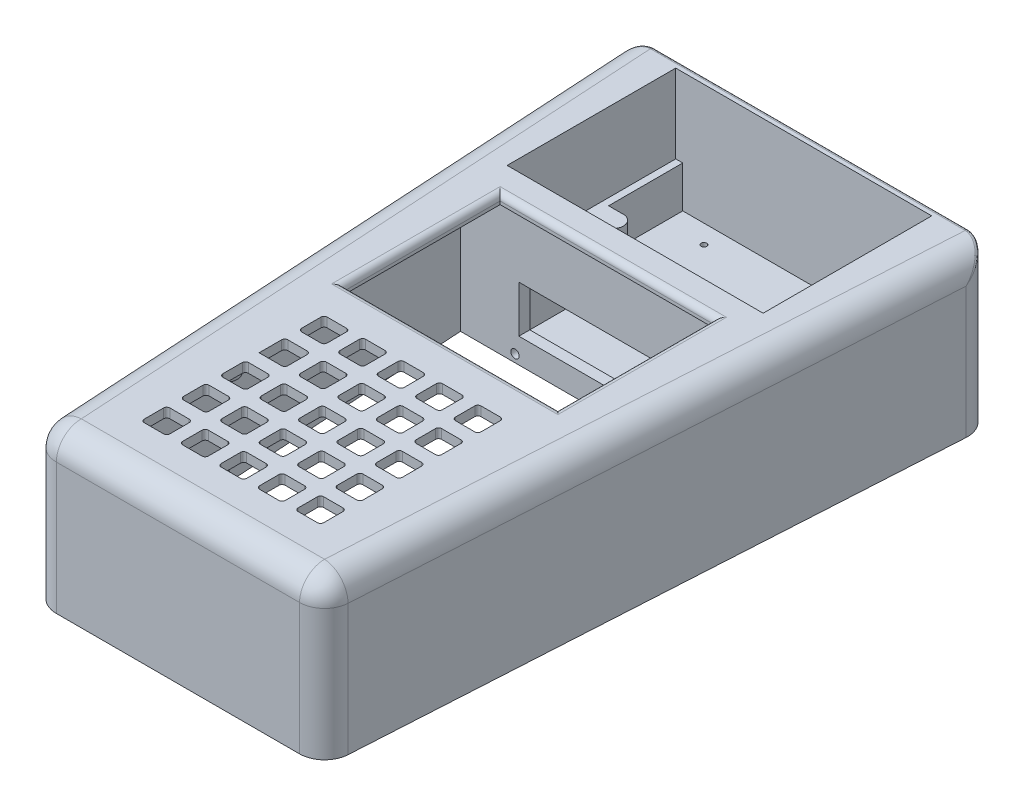
from build123d import *

# Parameters (mm, degrees)
BOSS_EXTRUDE1_DEPTH           = 50
CUT_EXTRUDE1_DEPTH            = 47
CUT_EXTRUDE2_DEPTH            = 47
BOSS_EXTRUDE2_DEPTH           = 21.8
BOSS_EXTRUDE3_DEPTH           = 8.5
CUT_EXTRUDE3_START            = -11.5
CUT_EXTRUDE3_DEPTH            = 9.5
CUT_EXTRUDE4_REACH            = 125.33
SKETCH7_R                     = 0.9
SKETCH9_W                     = 68.5
SKETCH9_H                     = 50
SKETCH9_W_2                   = 8.2
SKETCH9_H_2                   = 8.2
CUT_EXTRUDE5_DEPTH            = 3
SKETCH11_R                    = 4.5
BOSS_EXTRUDE4_DEPTH           = 4
BOSS_EXTRUDE4_DRAFT           = 10
BOSS_EXTRUDE4_PROFILE_2_DEPTH = 4
BOSS_EXTRUDE4_PROFILE_2_DRAFT = 10
BOSS_EXTRUDE4_PROFILE_3_DEPTH = 4
BOSS_EXTRUDE4_PROFILE_3_DRAFT = 10
BOSS_EXTRUDE4_PROFILE_4_DEPTH = 4
BOSS_EXTRUDE4_PROFILE_4_DRAFT = 10
SKETCH11_3_R                  = 1.5
CUT_EXTRUDE6_DEPTH            = 5.5
BOSS_EXTRUDE6_DEPTH           = 25.2
FILLET2_R                     = 8
SKETCH13_R                    = 1.35
CUT_EXTRUDE7_DEPTH            = 3.499991308
SKETCH14_R                    = 1.35
CUT_EXTRUDE8_DEPTH            = 2
SKETCH15_R                    = 1.35
CUT_EXTRUDE9_DEPTH            = 2
FILLET3_R                     = 8
BOSS_EXTRUDE8_START           = -47
BOSS_EXTRUDE8_DEPTH           = 47
FILLET4_R                     = 5
SKETCH18_R                    = 1.5
CUT_EXTRUDE10_DEPTH           = 8
FILLET5_R                     = 1
FILLET6_R                     = 2
FILLET7_R                     = 1.2
CUT_EXTRUDE11_REACH           = 167.321


with BuildPart() as part:
    # Sketch1 → Boss-Extrude1 (new body)
    with BuildSketch(Plane(origin=(0, 0, 0), x_dir=(1, 0, 0), z_dir=(0, 1, 0))):
        Polygon((-46.529702712, 101.499995654), (-58.529702712, 101.499995654), (-46.470297288, -101.499995654), (46.529702712, -101.499995654), (58.470297288, 101.499995654), (46.470297288, 101.499995654), align=None)
    extrude(amount=BOSS_EXTRUDE1_DEPTH)

    # Sketch2 → Cut-Extrude1 (cut)
    with BuildSketch(Plane.XZ):
        Polygon((52.436736768, -41.500004346), (-52.460939346, -41.500004346), (-44.114404692, 98.999995654), (44.172433272, 98.999995654), align=None)
    extrude(amount=-CUT_EXTRUDE1_DEPTH, mode=Mode.SUBTRACT)

    # Sketch3 → Cut-Extrude2 (cut)
    with BuildSketch(Plane(origin=(0, 50, 0), x_dir=(1, 0, 0), z_dir=(0, 1, 0))):
        Polygon((-52.668859621, 44.999995654), (52.642608586, 44.999995654), (55.81892452, 98.999995654), (-55.876780414, 98.999995654), align=None)
    extrude(amount=-CUT_EXTRUDE2_DEPTH, mode=Mode.SUBTRACT)

    # Sketch4 → Boss-Extrude2 (add)
    with BuildSketch(Plane(origin=(0, 3, 0), x_dir=(1, 0, 0), z_dir=(0, 1, 0))):
        with BuildLine():
            Line((38.723219586, 68.749995654), (33.973219586, 68.749995654))
            ThreePointArc((33.973219586, 68.749995654), (30.723219586, 71.999995654), (33.973219586, 75.249995654))
            Line((33.973219586, 75.249995654), (38.723219586, 75.249995654))
            Line((38.723219586, 75.249995654), (38.723219586, 98.999995654))
            Line((38.723219586, 98.999995654), (55.81892452, 98.999995654))
            Line((55.81892452, 98.999995654), (52.642608586, 44.999995654))
            Line((52.642608586, 44.999995654), (38.723219586, 44.999995654))
            Line((38.723219586, 44.999995654), (38.723219586, 68.749995654))
        make_face()
        with BuildLine():
            Line((-38.776780414, 75.249995654), (-34.026780414, 75.249995654))
            ThreePointArc((-34.026780414, 75.249995654), (-30.776780414, 71.999995654), (-34.026780414, 68.749995654))
            Line((-34.026780414, 68.749995654), (-38.776780414, 68.749995654))
            Line((-38.776780414, 68.749995654), (-38.776780414, 44.999995654))
            Line((-38.776780414, 44.999995654), (-52.668859621, 44.999995654))
            Line((-52.668859621, 44.999995654), (-55.876780414, 98.999995654))
            Line((-55.876780414, 98.999995654), (-38.776780414, 98.999995654))
            Line((-38.776780414, 98.999995654), (-38.776780414, 75.249995654))
        make_face()
    extrude(amount=BOSS_EXTRUDE2_DEPTH)

    # Sketch5 → Boss-Extrude3 (add)
    with BuildSketch(Plane(origin=(0, 3, 0), x_dir=(1, 0, 0), z_dir=(0, 1, 0))):
        with BuildLine():
            Line((-38.776780414, 62.499995654), (28.723219586, 62.499995654))
            Line((28.723219586, 62.499995654), (28.723219586, 44.999995654))
            Line((28.723219586, 44.999995654), (38.723219586, 44.999995654))
            Line((38.723219586, 44.999995654), (38.723219586, 68.749995654))
            Line((38.723219586, 68.749995654), (33.973219586, 68.749995654))
            ThreePointArc((33.973219586, 68.749995654), (30.723219586, 71.999995654), (33.973219586, 75.249995654))
            Line((33.973219586, 75.249995654), (38.723219586, 75.249995654))
            Line((38.723219586, 75.249995654), (38.723219586, 98.999995654))
            Line((38.723219586, 98.999995654), (-38.776780414, 98.999995654))
            Line((-38.776780414, 98.999995654), (-38.776780414, 75.249995654))
            Line((-38.776780414, 75.249995654), (-34.026780414, 75.249995654))
            ThreePointArc((-34.026780414, 75.249995654), (-30.776780414, 71.999995654), (-34.026780414, 68.749995654))
            Line((-34.026780414, 68.749995654), (-38.776780414, 68.749995654))
            Line((-38.776780414, 68.749995654), (-38.776780414, 62.499995654))
        make_face()
    extrude(amount=BOSS_EXTRUDE3_DEPTH)

    # Sketch6 → Cut-Extrude3 (cut)
    with BuildSketch(Plane(origin=(0, 11.5, 0), x_dir=(1, 0, 0), z_dir=(0, 1, 0)).offset(CUT_EXTRUDE3_START)):
        Polygon((-33.776780414, 63.999995654), (30.223219586, 63.999995654), (30.223219586, 49.999995654), (36.723219586, 49.999995654), (36.723219586, 95.999995654), (-33.776780414, 95.999995654), align=None)
    extrude(amount=CUT_EXTRUDE3_DEPTH, mode=Mode.SUBTRACT)

    # Sketch7 → Cut-Extrude4 (cut, up to next)
    with BuildSketch(Plane(origin=(0, 11.5, 0), x_dir=(1, 0, 0), z_dir=(0, 1, 0)), mode=Mode.PRIVATE) as cut_extrude4_sk1:
        with Locations(Location((-25.976780414, 92.999995654, 0), (0, 0, 270))):
            Circle(SKETCH7_R)
    cut_extrude4_tool1 = extrude(cut_extrude4_sk1.sketch, amount=-CUT_EXTRUDE4_REACH, mode=Mode.PRIVATE) & part.part
    # Sketch7 → Cut-Extrude4 (cut, up to next)
    with BuildSketch(Plane(origin=(0, 11.5, 0), x_dir=(1, 0, 0), z_dir=(0, 1, 0)), mode=Mode.PRIVATE) as cut_extrude4_sk2:
        with Locations(Location((-27.676780414, 68.099995654, 0), (0, 0, 270))):
            Circle(SKETCH7_R)
    cut_extrude4_tool2 = extrude(cut_extrude4_sk2.sketch, amount=-CUT_EXTRUDE4_REACH, mode=Mode.PRIVATE) & part.part
    # Sketch7 → Cut-Extrude4 (cut, up to next)
    with BuildSketch(Plane(origin=(0, 11.5, 0), x_dir=(1, 0, 0), z_dir=(0, 1, 0)), mode=Mode.PRIVATE) as cut_extrude4_sk3:
        with Locations(Location((25.923219586, 92.999995654, 0), (0, 0, 270))):
            Circle(SKETCH7_R)
    cut_extrude4_tool3 = extrude(cut_extrude4_sk3.sketch, amount=-CUT_EXTRUDE4_REACH, mode=Mode.PRIVATE) & part.part
    # Sketch7 → Cut-Extrude4 (cut, up to next)
    with BuildSketch(Plane(origin=(0, 11.5, 0), x_dir=(1, 0, 0), z_dir=(0, 1, 0)), mode=Mode.PRIVATE) as cut_extrude4_sk4:
        with Locations(Location((34.523219586, 57.999995654, 0), (0, 0, 270))):
            Circle(SKETCH7_R)
    cut_extrude4_tool4 = extrude(cut_extrude4_sk4.sketch, amount=-CUT_EXTRUDE4_REACH, mode=Mode.PRIVATE) & part.part
    add(cut_extrude4_tool1.solids().sort_by_distance((-25.97678, 11.5, -92.999996))[0], mode=Mode.SUBTRACT)
    add(cut_extrude4_tool2.solids().sort_by_distance((-27.67678, 11.5, -68.099996))[0], mode=Mode.SUBTRACT)
    add(cut_extrude4_tool3.solids().sort_by_distance((25.92322, 11.5, -92.999996))[0], mode=Mode.SUBTRACT)
    add(cut_extrude4_tool4.solids().sort_by_distance((34.52322, 11.5, -57.999996))[0], mode=Mode.SUBTRACT)

    # Sketch9 → Cut-Extrude5 (cut)
    with BuildSketch(Plane(origin=(0, 50, 0), x_dir=(1, 0, 0), z_dir=(0, 1, 0))):
        with Locations((-0.026780414, 10.999995654)):
            Rectangle(SKETCH9_W, SKETCH9_H)
        with Locations((-12.356780414, -30.000004346)):
            Rectangle(SKETCH9_W_2, SKETCH9_H_2)
        with Locations((-24.676780414, -30.000004346)):
            Rectangle(SKETCH9_W_2, SKETCH9_H_2)
        with Locations((-0.036780414, -30.000004346)):
            Rectangle(SKETCH9_W_2, SKETCH9_H_2)
        with Locations((12.283219586, -30.000004346)):
            Rectangle(SKETCH9_W_2, SKETCH9_H_2)
        with Locations((24.603219586, -30.000004346)):
            Rectangle(SKETCH9_W_2, SKETCH9_H_2)
        with Locations((-12.356780414, -42.600004346)):
            Rectangle(SKETCH9_W_2, SKETCH9_H_2)
        with Locations((-0.036780414, -42.600004346)):
            Rectangle(SKETCH9_W_2, SKETCH9_H_2)
        with Locations((12.283219586, -42.600004346)):
            Rectangle(SKETCH9_W_2, SKETCH9_H_2)
        with Locations((24.603219586, -42.600004346)):
            Rectangle(SKETCH9_W_2, SKETCH9_H_2)
        with Locations((-12.356780414, -55.200004346)):
            Rectangle(SKETCH9_W_2, SKETCH9_H_2)
        with Locations((-0.036780414, -55.200004346)):
            Rectangle(SKETCH9_W_2, SKETCH9_H_2)
        with Locations((12.283219586, -55.200004346)):
            Rectangle(SKETCH9_W_2, SKETCH9_H_2)
        with Locations((24.603219586, -55.200004346)):
            Rectangle(SKETCH9_W_2, SKETCH9_H_2)
        with Locations((-12.356780414, -67.800004346)):
            Rectangle(SKETCH9_W_2, SKETCH9_H_2)
        with Locations((-0.036780414, -67.800004346)):
            Rectangle(SKETCH9_W_2, SKETCH9_H_2)
        with Locations((12.283219586, -67.800004346)):
            Rectangle(SKETCH9_W_2, SKETCH9_H_2)
        with Locations((24.603219586, -67.800004346)):
            Rectangle(SKETCH9_W_2, SKETCH9_H_2)
        with Locations((-12.356780414, -80.400004346)):
            Rectangle(SKETCH9_W_2, SKETCH9_H_2)
        with Locations((-0.036780414, -80.400004346)):
            Rectangle(SKETCH9_W_2, SKETCH9_H_2)
        with Locations((12.283219586, -80.400004346)):
            Rectangle(SKETCH9_W_2, SKETCH9_H_2)
        with Locations((24.603219586, -80.400004346)):
            Rectangle(SKETCH9_W_2, SKETCH9_H_2)
        with Locations((-24.676780414, -42.600004346)):
            Rectangle(SKETCH9_W_2, SKETCH9_H_2)
        with Locations((-24.676780414, -55.200004346)):
            Rectangle(SKETCH9_W_2, SKETCH9_H_2)
        with Locations((-24.676780414, -67.800004346)):
            Rectangle(SKETCH9_W_2, SKETCH9_H_2)
        with Locations((-24.676780414, -80.400004346)):
            Rectangle(SKETCH9_W_2, SKETCH9_H_2)
    extrude(amount=-CUT_EXTRUDE5_DEPTH, mode=Mode.SUBTRACT)


with BuildPart() as boss_extrude4_tool:
    # Sketch11 → Boss-Extrude4 (with draft: the straight prism first)
    with BuildSketch(Plane.XZ.offset(-47)):
        with Locations((34.303219586, 20.300004346)):
            Circle(SKETCH11_R)
    extrude(amount=BOSS_EXTRUDE4_DEPTH)
    # Boss-Extrude4: the draft: its side faces are tilted about the plane it starts from
    boss_extrude4_sides = [boss_extrude4_tool.faces().sort_by_distance(p)[0] for p in [
        (29.803219586, 45, 20.300004346),
    ]]
    draft(boss_extrude4_sides, Plane.XZ.offset(-47), BOSS_EXTRUDE4_DRAFT)


with BuildPart() as part_1:
    add(part.part)

    # Boss-Extrude4: add boss_extrude4_tool
    add(boss_extrude4_tool.part)


with BuildPart() as boss_extrude4_profile_2_tool:
    # Sketch11 → Boss-Extrude4 profile 2 (with draft: the straight prism first)
    with BuildSketch(Plane.XZ.offset(-47)):
        with Locations((34.603219586, 84.500004346)):
            Circle(SKETCH11_R)
    extrude(amount=BOSS_EXTRUDE4_PROFILE_2_DEPTH)
    # Boss-Extrude4 profile 2: the draft: its side faces are tilted about the plane it starts from
    boss_extrude4_profile_2_sides = [boss_extrude4_profile_2_tool.faces().sort_by_distance(p)[0] for p in [
        (30.103219586, 45, 84.500004346),
    ]]
    draft(boss_extrude4_profile_2_sides, Plane.XZ.offset(-47), BOSS_EXTRUDE4_PROFILE_2_DRAFT)


with BuildPart() as part_2:
    add(part_1.part)

    # Boss-Extrude4 profile 2: add boss_extrude4_profile_2_tool
    add(boss_extrude4_profile_2_tool.part)


with BuildPart() as boss_extrude4_profile_3_tool:
    # Sketch11 → Boss-Extrude4 profile 3 (with draft: the straight prism first)
    with BuildSketch(Plane.XZ.offset(-47)):
        with Locations((-37.676780414, 20.300004346)):
            Circle(SKETCH11_R)
    extrude(amount=BOSS_EXTRUDE4_PROFILE_3_DEPTH)
    # Boss-Extrude4 profile 3: the draft: its side faces are tilted about the plane it starts from
    boss_extrude4_profile_3_sides = [boss_extrude4_profile_3_tool.faces().sort_by_distance(p)[0] for p in [
        (-42.176780414, 45, 20.300004346),
    ]]
    draft(boss_extrude4_profile_3_sides, Plane.XZ.offset(-47), BOSS_EXTRUDE4_PROFILE_3_DRAFT)


with BuildPart() as part_3:
    add(part_2.part)

    # Boss-Extrude4 profile 3: add boss_extrude4_profile_3_tool
    add(boss_extrude4_profile_3_tool.part)


with BuildPart() as boss_extrude4_profile_4_tool:
    # Sketch11 → Boss-Extrude4 profile 4 (with draft: the straight prism first)
    with BuildSketch(Plane.XZ.offset(-47)):
        with Locations((-35.676780414, 50.600004346)):
            Circle(SKETCH11_R)
    extrude(amount=BOSS_EXTRUDE4_PROFILE_4_DEPTH)
    # Boss-Extrude4 profile 4: the draft: its side faces are tilted about the plane it starts from
    boss_extrude4_profile_4_sides = [boss_extrude4_profile_4_tool.faces().sort_by_distance(p)[0] for p in [
        (-40.176780414, 45, 50.600004346),
    ]]
    draft(boss_extrude4_profile_4_sides, Plane.XZ.offset(-47), BOSS_EXTRUDE4_PROFILE_4_DRAFT)


with BuildPart() as part_4:
    add(part_3.part)

    # Boss-Extrude4 profile 4: add boss_extrude4_profile_4_tool
    add(boss_extrude4_profile_4_tool.part)

    # Sketch11<3> → Cut-Extrude6 (cut)
    with BuildSketch(Plane.XZ.offset(-47)):
        with Locations(Location((34.303219586, 20.300004346, 0), (0, 0, 270))):
            Circle(SKETCH11_3_R)
        with Locations(Location((-37.676780414, 20.300004346, 0), (0, 0, 270))):
            Circle(SKETCH11_3_R)
        with Locations(Location((-35.676780414, 50.600004346, 0), (0, 0, 270))):
            Circle(SKETCH11_3_R)
        with Locations(Location((34.603219586, 84.500004346, 0), (0, 0, 270))):
            Circle(SKETCH11_3_R)
    extrude(amount=CUT_EXTRUDE6_DEPTH, mode=Mode.SUBTRACT)

    # Sketch12 → Boss-Extrude6 (add)
    with BuildSketch(Plane(origin=(0, 24.8, 0), x_dir=(1, 0, 0), z_dir=(0, 1, 0))):
        Polygon((55.81892452, 98.999995654), (52.642608586, 44.999995654), (40.973219586, 44.999995654), (40.973219586, 98.999995654), align=None)
        Polygon((-52.668859621, 44.999995654), (-55.876780414, 98.999995654), (-41.026780414, 98.999995654), (-41.026780414, 44.999995654), align=None)
    extrude(amount=BOSS_EXTRUDE6_DEPTH)

    # Fillet2
    fillet2_edges = [part_4.edges().sort_by_distance(p)[0] for p in [
        (-58.529702712, 25, -101.499995654),
        (58.470297288, 25, -101.499995654),
        (46.529702712, 25, 101.499995654),
        (-46.470297288, 25, 101.499995654),
        (52.5, 50, 0),
        (-52.5, 50, 0),
        (0.029702712, 50, 101.499995654),
    ]]
    fillet(fillet2_edges, radius=FILLET2_R)

    # Sketch13 → Cut-Extrude7 (cut)
    with BuildSketch(Plane.XY.offset(-41.500004346)):
        with Locations((-35.010638101, 2.5)):
            Circle(SKETCH13_R)
        with Locations((34.986440661, 2.5)):
            Circle(SKETCH13_R)
    extrude(amount=-CUT_EXTRUDE7_DEPTH, mode=Mode.SUBTRACT)

    # Sketch14 → Cut-Extrude8 (cut)
    with BuildSketch(Plane(origin=(-49.819775289, 0, 2.959590611), x_dir=(-0.05930139349204842, 0, -0.9982401237828007), z_dir=(0.9982401237828007, 0, -0.05930139349204842))):
        with Locations((-35.594247131, 2.5)):
            Circle(SKETCH14_R)
    extrude(amount=-CUT_EXTRUDE8_DEPTH, mode=Mode.SUBTRACT)

    # Sketch15 → Cut-Extrude9 (cut)
    with BuildSketch(Plane(origin=(49.823296732, 0, 2.930639469), x_dir=(-0.05871917279322015, 0, 0.9982745407684602), z_dir=(-0.9982745407684602, 0, -0.05871917279322015))):
        with Locations((35.611780923, 2.5)):
            Circle(SKETCH15_R)
    extrude(amount=-CUT_EXTRUDE9_DEPTH, mode=Mode.SUBTRACT)

    # Fillet3
    fillet3_edges = [part_4.edges().sort_by_distance(p)[0] for p in [
        (44.172433272, 23.5, 98.999995654),
        (-44.114404692, 23.5, 98.999995654),
    ]]
    fillet(fillet3_edges, radius=FILLET3_R)

    # Sketch17 → Boss-Extrude8 (add)
    with BuildSketch(Plane.XZ.offset(BOSS_EXTRUDE8_START)):
        with BuildLine():
            Line((-44.561469377, 91.474406802), (-36.575548386, 90.999995654))
            Line((-36.575548386, 90.999995654), (-36.575548386, 98.999995654))
            ThreePointArc((-36.575548386, 98.999995654), (-42.062109733, 96.822164029), (-44.561469377, 91.474406802))
        make_face()
        with BuildLine():
            Line((44.615367389, 91.469749036), (36.629171063, 90.999995654))
            Line((36.629171063, 90.999995654), (36.629171063, 98.999995654))
            ThreePointArc((36.629171063, 98.999995654), (42.117430028, 96.820563799), (44.615367389, 91.469749036))
        make_face()
    extrude(amount=BOSS_EXTRUDE8_DEPTH)

    # Fillet4
    fillet4_edges = [part_4.edges().sort_by_distance(p)[0] for p in [
        (36.629171063, 23.5, 90.999995654),
        (-36.575548386, 23.5, 90.999995654),
    ]]
    fillet(fillet4_edges, radius=FILLET4_R)

    # Sketch18 → Cut-Extrude10 (cut)
    with BuildSketch(Plane.XZ):
        with Locations(Location((49.985904432, -93.499995654, 0), (0, 0, 270))):
            Circle(SKETCH18_R)
        with Locations(Location((-50.040351357, -93.499995654, 0), (0, 0, 270))):
            Circle(SKETCH18_R)
        with Locations(Location((40.629171063, 95.242192082, 0), (0, 0, 270))):
            Circle(SKETCH18_R)
        with Locations(Location((-40.575548386, 95.244671332, 0), (0, 0, 270))):
            Circle(SKETCH18_R)
    extrude(amount=-CUT_EXTRUDE10_DEPTH, mode=Mode.SUBTRACT)

    # Fillet5
    fillet5_edges = [part_4.edges().sort_by_distance(p)[0] for p in [
        (28.703219586, 48.5, 84.500004346),
        (20.503219586, 48.5, 84.500004346),
        (20.503219586, 48.5, 76.300004346),
        (28.703219586, 48.5, 76.300004346),
        (-20.576780414, 48.5, 46.700004346),
        (-28.776780414, 48.5, 38.500004346),
        (-20.576780414, 48.5, 38.500004346),
        (-20.576780414, 48.5, 59.300004346),
        (-28.776780414, 48.5, 59.300004346),
        (-28.776780414, 48.5, 51.100004346),
        (-20.576780414, 48.5, 51.100004346),
        (-20.576780414, 48.5, 71.900004346),
        (-28.776780414, 48.5, 71.900004346),
        (-28.776780414, 48.5, 63.700004346),
        (-20.576780414, 48.5, 63.700004346),
        (28.703219586, 48.5, 71.900004346),
        (20.503219586, 48.5, 71.900004346),
        (20.503219586, 48.5, 63.700004346),
        (28.703219586, 48.5, 63.700004346),
        (-8.256780414, 48.5, 84.500004346),
        (-16.456780414, 48.5, 84.500004346),
        (-16.456780414, 48.5, 76.300004346),
        (-8.256780414, 48.5, 76.300004346),
        (4.063219586, 48.5, 84.500004346),
        (-4.136780414, 48.5, 84.500004346),
        (-4.136780414, 48.5, 76.300004346),
        (4.063219586, 48.5, 76.300004346),
        (16.383219586, 48.5, 84.500004346),
        (8.183219586, 48.5, 84.500004346),
        (8.183219586, 48.5, 76.300004346),
        (16.383219586, 48.5, 76.300004346),
        (-20.576780414, 48.5, 84.500004346),
        (-28.776780414, 48.5, 84.500004346),
        (-28.776780414, 48.5, 76.300004346),
        (-20.576780414, 48.5, 76.300004346),
        (28.703219586, 48.5, 34.100004346),
        (20.503219586, 48.5, 34.100004346),
        (20.503219586, 48.5, 25.900004346),
        (28.703219586, 48.5, 25.900004346),
        (-8.256780414, 48.5, 46.700004346),
        (-16.456780414, 48.5, 46.700004346),
        (-16.456780414, 48.5, 38.500004346),
        (-8.256780414, 48.5, 38.500004346),
        (4.063219586, 48.5, 46.700004346),
        (-4.136780414, 48.5, 46.700004346),
        (-4.136780414, 48.5, 38.500004346),
        (4.063219586, 48.5, 38.500004346),
        (16.383219586, 48.5, 46.700004346),
        (8.183219586, 48.5, 46.700004346),
        (8.183219586, 48.5, 38.500004346),
        (16.383219586, 48.5, 38.500004346),
        (16.383219586, 48.5, 34.100004346),
        (8.183219586, 48.5, 34.100004346),
        (8.183219586, 48.5, 25.900004346),
        (16.383219586, 48.5, 25.900004346),
        (4.063219586, 48.5, 34.100004346),
        (-4.136780414, 48.5, 34.100004346),
        (-4.136780414, 48.5, 25.900004346),
        (4.063219586, 48.5, 25.900004346),
        (-8.256780414, 48.5, 34.100004346),
        (-16.456780414, 48.5, 34.100004346),
        (-16.456780414, 48.5, 25.900004346),
        (-8.256780414, 48.5, 25.900004346),
        (-20.576780414, 48.5, 25.900004346),
        (-20.576780414, 48.5, 34.100004346),
        (-28.776780414, 48.5, 34.100004346),
        (-28.776780414, 48.5, 25.900004346),
        (28.703219586, 48.5, 59.300004346),
        (20.503219586, 48.5, 59.300004346),
        (20.503219586, 48.5, 51.100004346),
        (28.703219586, 48.5, 51.100004346),
        (-8.256780414, 48.5, 71.900004346),
        (-16.456780414, 48.5, 71.900004346),
        (-16.456780414, 48.5, 63.700004346),
        (-8.256780414, 48.5, 63.700004346),
        (4.063219586, 48.5, 71.900004346),
        (-4.136780414, 48.5, 71.900004346),
        (-4.136780414, 48.5, 63.700004346),
        (4.063219586, 48.5, 63.700004346),
        (16.383219586, 48.5, 71.900004346),
        (8.183219586, 48.5, 71.900004346),
        (8.183219586, 48.5, 63.700004346),
        (16.383219586, 48.5, 63.700004346),
        (28.703219586, 48.5, 46.700004346),
        (20.503219586, 48.5, 46.700004346),
        (20.503219586, 48.5, 38.500004346),
        (28.703219586, 48.5, 38.500004346),
        (-8.256780414, 48.5, 59.300004346),
        (-16.456780414, 48.5, 59.300004346),
        (-16.456780414, 48.5, 51.100004346),
        (-8.256780414, 48.5, 51.100004346),
        (4.063219586, 48.5, 59.300004346),
        (-4.136780414, 48.5, 59.300004346),
        (-4.136780414, 48.5, 51.100004346),
        (4.063219586, 48.5, 51.100004346),
        (16.383219586, 48.5, 59.300004346),
        (8.183219586, 48.5, 59.300004346),
        (8.183219586, 48.5, 51.100004346),
        (16.383219586, 48.5, 51.100004346),
    ]]
    fillet(fillet5_edges, radius=FILLET5_R)

    # Fillet6
    fillet6_edges = [part_4.edges().sort_by_distance(p)[0] for p in [
        (-34.276780414, 50, -10.999995654),
        (-0.026780414, 50, 14.000004346),
        (34.223219586, 50, -10.999995654),
        (-0.026780414, 50, -35.999995654),
    ]]
    fillet(fillet6_edges, radius=FILLET6_R)

    # Fillet7
    fillet7_edges = [part_4.edges().sort_by_distance(p)[0] for p in [
        (-0.027223463, 50, -101.499995654),
        (-50.277661363, 50, -101.496475127),
        (50.220882506, 50, -101.496543991),
        (-56.442465843, 47.168391259, -98.297175045),
        (56.385219936, 47.168391259, -98.300908179),
    ]]
    fillet(fillet7_edges, radius=FILLET7_R)

    # Sketch19 → Cut-Extrude11 (cut, up to next)
    with BuildSketch(Plane(origin=(0, 0, -44.999995654), x_dir=(-1, 0, 0), z_dir=(0, 0, -1)), mode=Mode.PRIVATE) as cut_extrude11_sk1:
        Polygon((31.836917887, 8), (33.776780414, 8), (33.776780414, 8.728972243), (33.776780414, 23), (-33.723219586, 23), (-33.723219586, 16.5), (-23.723219586, 16.5), (-23.723219586, 8), align=None)
    cut_extrude11_tool1 = extrude(cut_extrude11_sk1.sketch, amount=-CUT_EXTRUDE11_REACH, mode=Mode.PRIVATE) & part_4.part
    add(cut_extrude11_tool1.solids().sort_by_distance((-2.661551, 15.797844, -44.999996))[0], mode=Mode.SUBTRACT)


solid = part_4.part
